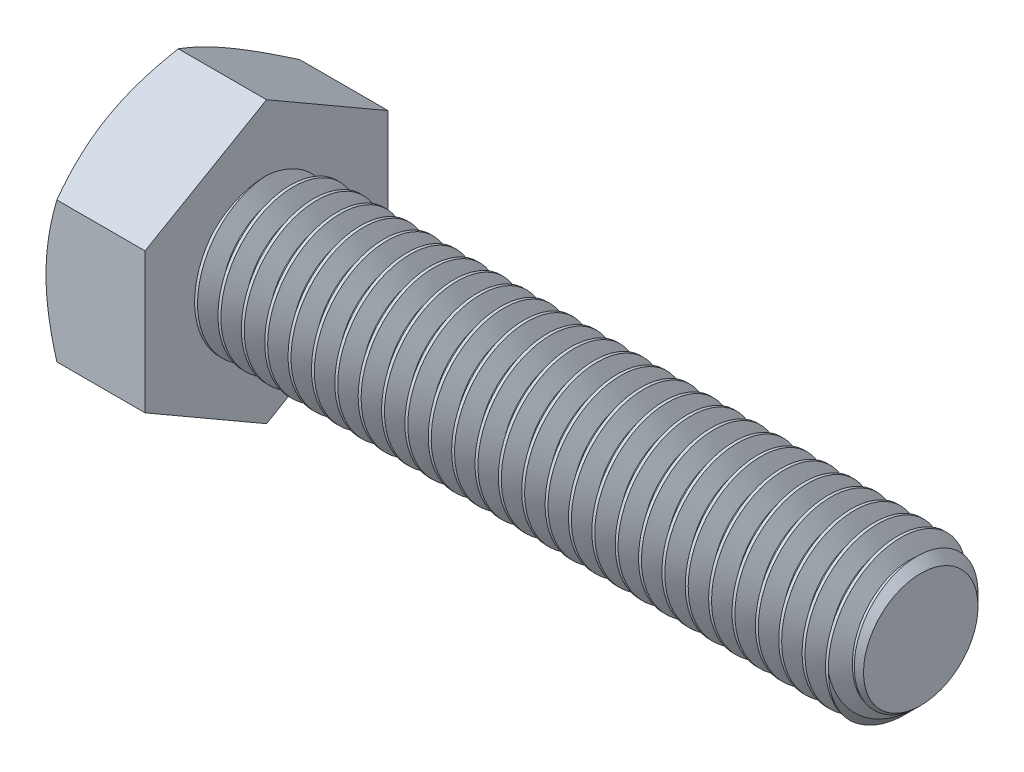
from build123d import *

# Parameters (mm, degrees)
SKETCH2_R           = 4
BOSS_EXTRUDE1_DEPTH = 35
CHAMFER1_SIZE       = 0.9375
CUT_SWEEP1_PITCH    = 1.25
BOSS_EXTRUDE2_DEPTH = 5.3
SKETCH6_OUTSIDE_W   = 171.228
SKETCH6_OUTSIDE_H   = 173.24
SKETCH6_OUTSIDE_R   = 6.5
CUT_EXTRUDE1_DEPTH  = 42.505100219
CUT_EXTRUDE1_DRAFT  = -60


with BuildPart() as part:
    # Sketch2 → Boss-Extrude1 (new body)
    with BuildSketch(Plane(origin=(20.15, 0, 0), x_dir=(0, 0, -1), z_dir=(1, 0, 0))):
        Circle(SKETCH2_R)
    extrude(amount=-BOSS_EXTRUDE1_DEPTH)

    # Chamfer1
    chamfer1_edges = [part.edges().sort_by_distance(p)[0] for p in [
        (20.15, 0, 4),
    ]]
    chamfer(chamfer1_edges, length=CHAMFER1_SIZE)

    # Cut-Sweep1: arcs per turn and ends read off the stored shape
    # Cut-Sweep1: the profile of Sketch5 profile screwed along a right-hand helix through 29 turns, 8 arcs to a turn; built about Z, then put on its axis
    cut_sweep1_z = Axis((0, 0, 0), (0, 0, 1))
    cut_sweep1_corners = [(4.0003, 0, 0.000173205), (3.188101184, 0, -0.46875), (3.188101184, 0, -0.625), (4.0003, 0, -1.093923205)]
    with BuildLine(mode=Mode.PRIVATE) as cut_sweep1_profile:
        Line(cut_sweep1_corners[0], cut_sweep1_corners[1])
        Line(cut_sweep1_corners[1], cut_sweep1_corners[2])
        Line(cut_sweep1_corners[2], cut_sweep1_corners[3])
        Line(cut_sweep1_corners[3], cut_sweep1_corners[0])
    cut_sweep1_cap = Face(cut_sweep1_profile.wire())
    cut_sweep1_turn_angles = [0, 22.5, 45, 67.5, 90, 112.5, 135, 157.5, 180, 202.5, 225, 247.5, 270, 292.5, 315, 337.5, 360]
    cut_sweep1_turn_weights = [1, 0.9238795325112867, 1, 0.9238795325112867, 1, 0.9238795325112867, 1, 0.9238795325112867, 1, 0.9238795325112867, 1, 0.9238795325112867, 1, 0.9238795325112867, 1, 0.9238795325112867, 1]
    cut_sweep1_turn_rails = [Edge.make_bspline([Vector(p[0], p[1], 0).rotate(cut_sweep1_z, cut_sweep1_turn_angles[k]) / cut_sweep1_turn_weights[k] + Vector(0, 0, p[2] + CUT_SWEEP1_PITCH * cut_sweep1_turn_angles[k] / 360) for k in range(17)], [0, 0, 0, 1, 1, 2, 2, 3, 3, 4, 4, 5, 5, 6, 6, 7, 7, 8, 8, 8], 2, cut_sweep1_turn_weights) for p in cut_sweep1_corners]
    cut_sweep1_turn_sides = [Face.make_surface_from_curves(cut_sweep1_turn_rails[p[0]], cut_sweep1_turn_rails[p[1]]) for p in [(0, 1), (1, 2), (2, 3), (3, 0)]]
    cut_sweep1 = Plane(origin=(20.15, 0, 0), x_dir=(0, 1, 0), z_dir=(-1, 0, 0)) * Solid(Shell([*[p.moved(Location((0, 0, CUT_SWEEP1_PITCH * i))) for i in range(29) for p in cut_sweep1_turn_sides], cut_sweep1_cap, cut_sweep1_cap.rotate(cut_sweep1_z, 10440).moved(Location((0, 0, CUT_SWEEP1_PITCH * 10440 / 360)))]))
    add(cut_sweep1, mode=Mode.SUBTRACT)

    # Sketch3 → Boss-Extrude2 (add)
    with BuildSketch(Plane.ZY.offset(14.85)):
        Polygon((-6.5, -3.75277675), (0, -7.505553499), (6.5, -3.75277675), (6.5, 3.75277675), (0, 7.505553499), (-6.5, 3.75277675), align=None)
    extrude(amount=BOSS_EXTRUDE2_DEPTH)


with BuildPart() as cut_extrude1_tool:
    # Sketch6 outside → Cut-Extrude1 (with draft: the straight prism first)
    with BuildSketch(Plane.ZY.offset(20.15)):
        Rectangle(SKETCH6_OUTSIDE_W, SKETCH6_OUTSIDE_H)
        Circle(SKETCH6_OUTSIDE_R, mode=Mode.SUBTRACT)
    extrude(amount=-CUT_EXTRUDE1_DEPTH)
    # Cut-Extrude1: the draft: its side faces are tilted about the plane it starts from
    cut_extrude1_sides = [cut_extrude1_tool.faces().sort_by_distance(p)[0] for p in [
        (1.10255011, -86.62, 0),
        (1.10255011, 0, 85.614),
        (1.10255011, 86.62, 0),
        (1.10255011, 0, -85.614),
        (1.10255011, 0, -6.5),
    ]]
    draft(cut_extrude1_sides, Plane.ZY.offset(20.15), CUT_EXTRUDE1_DRAFT)


with BuildPart() as part_1:
    add(part.part)

    # Cut-Extrude1: cut by cut_extrude1_tool
    add(cut_extrude1_tool.part, mode=Mode.SUBTRACT)


solid = part_1.part
